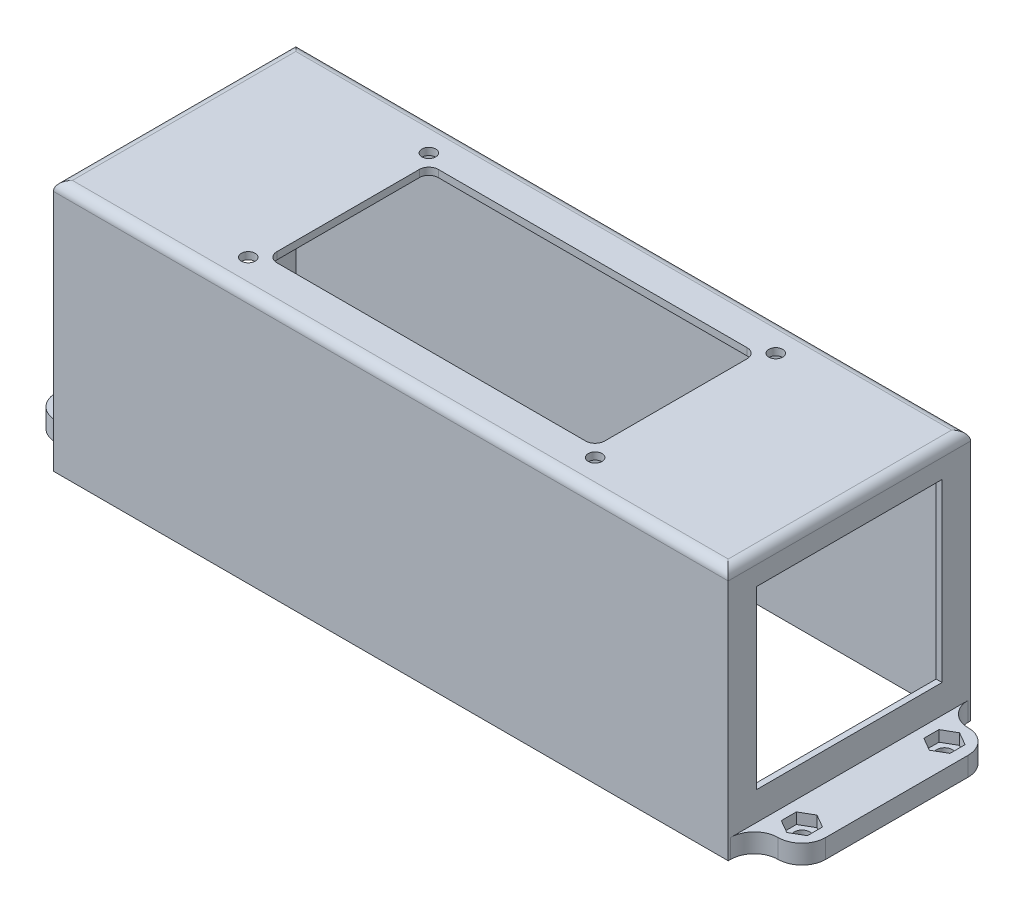
from build123d import *

# Parameters (mm, degrees)
SKETCH1_W                 = 142
SKETCH1_H                 = 51
BOSS_EXTRUDE1_DEPTH       = 53
SHELL1_T                  = -1.25
SHELL1_THICKNESS_2_FACE_W = 48.5
SHELL1_THICKNESS_2_FACE_H = 139.5
SHELL1_THICKNESS_2_DEPTH  = 0.25
SKETCH2_W                 = 10
SKETCH2_H                 = 40
SKETCH2_R                 = 1.65
BOSS_EXTRUDE2_DEPTH       = 4
SKETCH3_W                 = 39
SKETCH3_H                 = 37
CUT_EXTRUDE1_DEPTH        = 169.860889492
CUT_EXTRUDE2_DEPTH        = 2.3
FILLET2_START             = -1
FILLET2_DEPTH             = 5
FILLET2_2_DEPTH           = 4
SKETCH5_R                 = 1.45
CUT_EXTRUDE3_DEPTH        = 169.860889492
SKETCH7_W                 = 69
SKETCH7_H                 = 34
CUT_EXTRUDE4_DEPTH        = 169.860889492
FILLET6_R                 = 2
FILLET7_R                 = 2


with BuildPart() as part:
    # Sketch1 → Boss-Extrude1 (new body)
    with BuildSketch(Plane(origin=(0, 0, 0), x_dir=(1, 0, 0), z_dir=(0, 1, 0))):
        with Locations((71, 25.5)):
            Rectangle(SKETCH1_W, SKETCH1_H)
    extrude(amount=BOSS_EXTRUDE1_DEPTH)

    # Shell1
    shell1_openings = [part.faces().sort_by_distance(p)[0] for p in [
        (71, 0, -25.5),
    ]]
    offset(amount=SHELL1_T, openings=shell1_openings, kind=Kind.INTERSECTION)

    # Shell1 thickness 2 face (on inner face of the shell) → Shell1 thickness 2 (add)
    with BuildSketch(Plane(origin=(71, 51.75, -25.5), x_dir=(0, 0, 1), z_dir=(0, 1, 0))):
        Rectangle(SHELL1_THICKNESS_2_FACE_W, SHELL1_THICKNESS_2_FACE_H)
    extrude(amount=-SHELL1_THICKNESS_2_DEPTH)

    # Sketch2 → Boss-Extrude2 (add)
    # profile 1 of 2: a face of its own
    with BuildSketch(Plane.XZ):
        with Locations((147, -25.5)):
            Rectangle(SKETCH2_W, SKETCH2_H)
        with Locations(Location((147, -40.5, 0), (0, 0, 270))):
            Circle(SKETCH2_R, mode=Mode.SUBTRACT)
        with Locations(Location((147, -10.5, 0), (0, 0, 270))):
            Circle(SKETCH2_R, mode=Mode.SUBTRACT)
    # profile 2 of 2: a face of its own
    with BuildSketch(Plane.XZ):
        with Locations((-5, -25.5)):
            Rectangle(SKETCH2_W, SKETCH2_H)
        with Locations(Location((-5, -40.5, 0), (0, 0, 270))):
            Circle(SKETCH2_R, mode=Mode.SUBTRACT)
        with Locations(Location((-5, -10.5, 0), (0, 0, 270))):
            Circle(SKETCH2_R, mode=Mode.SUBTRACT)
    extrude(amount=-BOSS_EXTRUDE2_DEPTH)

    # Sketch3 → Cut-Extrude1 (cut, through all)
    with BuildSketch(Plane(origin=(142, 0, 0), x_dir=(0, 0, -1), z_dir=(1, 0, 0))):
        with Locations((25.5, 28.5)):
            Rectangle(SKETCH3_W, SKETCH3_H)
    extrude(amount=-CUT_EXTRUDE1_DEPTH, mode=Mode.SUBTRACT)

    # Sketch4 → Cut-Extrude2 (cut)
    with BuildSketch(Plane(origin=(0, 4, 0), x_dir=(1, 0, 0), z_dir=(0, 1, 0))):
        Polygon((-5, 43.675426481), (-7.75, 42.08771324), (-7.75, 38.91228676), (-5, 37.324573519), (-2.25, 38.91228676), (-2.25, 42.08771324), align=None)
        Polygon((-5, 13.675426481), (-7.75, 12.08771324), (-7.75, 8.91228676), (-5, 7.324573519), (-2.25, 8.91228676), (-2.25, 12.08771324), align=None)
        Polygon((147, 43.675426481), (144.25, 42.08771324), (144.25, 38.91228676), (147, 37.324573519), (149.75, 38.91228676), (149.75, 42.08771324), align=None)
        Polygon((147, 13.675426481), (144.25, 12.08771324), (144.25, 8.91228676), (147, 7.324573519), (149.75, 8.91228676), (149.75, 12.08771324), align=None)
    extrude(amount=-CUT_EXTRUDE2_DEPTH, mode=Mode.SUBTRACT)

    # Fillet2: read off the stored shape, not the designer's step
    # Fillet2 outline → Fillet2 (cut)
    with BuildSketch(Plane(origin=(0, 0, 0), x_dir=(1, 0, 0), z_dir=(0, 1, 0)).offset(FILLET2_START)):
        with BuildLine():
            Line((-10, 5.5), (-5, 5.5))
            ThreePointArc((-5, 5.5), (-8.535533906, 6.964466094), (-10, 10.5))
            Line((-10, 10.5), (-10, 5.5))
        make_face()
        with BuildLine():
            Line((-10, 45.5), (-10, 40.5))
            ThreePointArc((-10, 40.5), (-8.535533906, 44.035533906), (-5, 45.5))
            Line((-5, 45.5), (-10, 45.5))
        make_face()
        with BuildLine():
            ThreePointArc((152, 10.5), (150.535533906, 6.964466094), (147, 5.5))
            Line((147, 5.5), (152, 5.5))
            Line((152, 5.5), (152, 10.5))
        make_face()
        with BuildLine():
            ThreePointArc((147, 45.5), (150.535533906, 44.035533906), (152, 40.5))
            Line((152, 40.5), (152, 45.5))
            Line((152, 45.5), (147, 45.5))
        make_face()
    extrude(amount=FILLET2_DEPTH, mode=Mode.SUBTRACT)

    # Fillet2 2 outline → Fillet2 2 (add)
    with BuildSketch(Plane(origin=(0, 0, 0), x_dir=(1, 0, 0), z_dir=(0, 1, 0))):
        with BuildLine():
            Line((0, 5.5), (-5, 5.5))
            ThreePointArc((-5, 5.5), (-1.464466094, 4.035533906), (0, 0.5))
            Line((0, 0.5), (0, 5.5))
        make_face()
        with BuildLine():
            Line((-5, 45.5), (0, 45.5))
            Line((0, 45.5), (0, 50.5))
            ThreePointArc((0, 50.5), (-1.464466094, 46.964466094), (-5, 45.5))
        make_face()
        with BuildLine():
            ThreePointArc((142, 0.5), (143.464466094, 4.035533906), (147, 5.5))
            Line((147, 5.5), (142, 5.5))
            Line((142, 5.5), (142, 0.5))
        make_face()
        with BuildLine():
            Line((142, 50.5), (142, 45.5))
            Line((142, 45.5), (147, 45.5))
            ThreePointArc((147, 45.5), (143.464466094, 46.964466094), (142, 50.5))
        make_face()
    extrude(amount=FILLET2_2_DEPTH)

    # Sketch5 → Cut-Extrude3 (cut, through all)
    with BuildSketch(Plane(origin=(0, 53, 0), x_dir=(1, 0, 0), z_dir=(0, 1, 0))):
        with Locations(Location((34.5, 44.5, 0), (0, 0, 270))):
            Circle(SKETCH5_R)
        with Locations(Location((34.5, 6.5, 0), (0, 0, 270))):
            Circle(SKETCH5_R)
        with Locations(Location((107.5, 6.5, 0), (0, 0, 270))):
            Circle(SKETCH5_R)
        with Locations(Location((107.5, 44.5, 0), (0, 0, 270))):
            Circle(SKETCH5_R)
    extrude(amount=-CUT_EXTRUDE3_DEPTH, mode=Mode.SUBTRACT)

    # Sketch7 → Cut-Extrude4 (cut, through all)
    with BuildSketch(Plane(origin=(0, 53, 0), x_dir=(1, 0, 0), z_dir=(0, 1, 0))):
        with Locations((71, 25.5)):
            Rectangle(SKETCH7_W, SKETCH7_H)
    extrude(amount=-CUT_EXTRUDE4_DEPTH, mode=Mode.SUBTRACT)

    # Fillet6
    fillet6_edges = [part.edges().sort_by_distance(p)[0] for p in [
        (36.5, 52.25, -8.5),
        (36.5, 52.25, -42.5),
        (105.5, 52.25, -42.5),
        (105.5, 52.25, -8.5),
    ]]
    fillet(fillet6_edges, radius=FILLET6_R)

    # Fillet7
    fillet7_edges = [part.edges().sort_by_distance(p)[0] for p in [
        (142, 53, -25.5),
        (71, 53, -51),
        (0, 53, -25.5),
        (71, 53, 0),
    ]]
    fillet(fillet7_edges, radius=FILLET7_R)


solid = part.part
